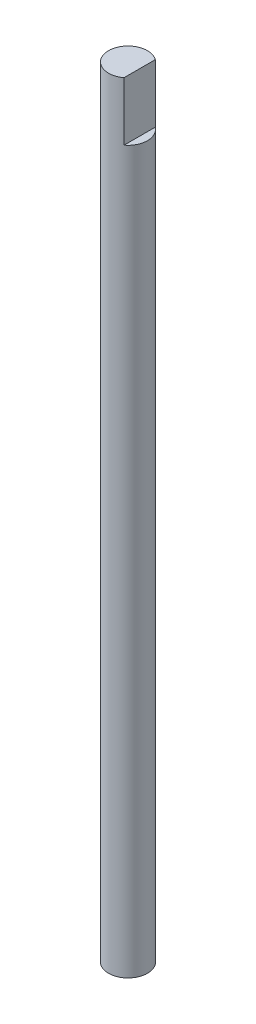
from build123d import *

# Parameters (mm, degrees)
SKETCH1_R       = 5
BASE_DEPTH      = 200
SLOT_DEPTH      = 201.124960962
SLOT_DEPTH_BACK = 201.124960962
SKETCH2_W       = 2
SKETCH2_H       = 16.134958609


with BuildPart() as part:
    # Sketch1 → Base (new body)
    with BuildSketch(Plane(origin=(0, 0, 0), x_dir=(1, 0, 0), z_dir=(0, 1, 0))):
        Circle(SKETCH1_R)
    extrude(amount=BASE_DEPTH)

    # Sketch2 → Slot (cut, two sides: drawn at the far end of the back side and taken through both)
    with BuildSketch(Plane.XY.offset(-SLOT_DEPTH_BACK)):
        with Locations((4, 193.067479305)):
            Rectangle(SKETCH2_W, SKETCH2_H)
    extrude(amount=SLOT_DEPTH + SLOT_DEPTH_BACK, mode=Mode.SUBTRACT)


solid = part.part
